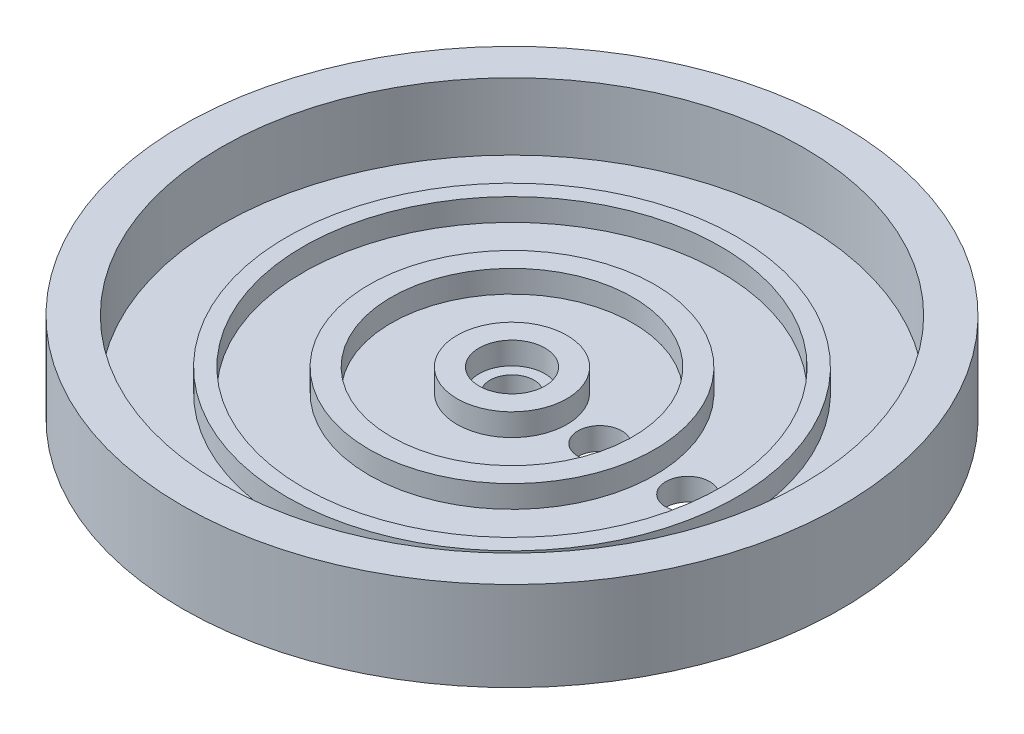
from build123d import *

# Parameters (mm, degrees)
SKETCH2_R           = 15
SKETCH2_R_2         = 1
BOSS_EXTRUDE2_DEPTH = 1.016
SKETCH3_R           = 15
SKETCH3_R_2         = 13.25
SKETCH3_R_3         = 10.25
SKETCH3_R_4         = 9.5
SKETCH3_R_5         = 6.5
SKETCH3_R_6         = 5.5
SKETCH3_R_7         = 2.5
SKETCH3_R_8         = 1.5
BOSS_EXTRUDE4_DEPTH = 1.016
SKETCH5_R           = 15
SKETCH5_R_2         = 13.25
BOSS_EXTRUDE5_DEPTH = 2.032


with BuildPart() as part:
    # Sketch2 → Boss-Extrude2 (new body)
    with BuildSketch(Plane(origin=(0, 0, 0), x_dir=(1, 0, 0), z_dir=(0, 1, 0))):
        Circle(SKETCH2_R)
        Circle(SKETCH2_R_2, mode=Mode.SUBTRACT)
        with Locations((4, 0)):
            Circle(SKETCH2_R_2, mode=Mode.SUBTRACT)
        with Locations((8, 0)):
            Circle(SKETCH2_R_2, mode=Mode.SUBTRACT)
    extrude(amount=BOSS_EXTRUDE2_DEPTH)

    # Sketch3 → Boss-Extrude4 (add)
    # profile 1 of 4: a face of its own
    with BuildSketch(Plane(origin=(0, 1.016, 0), x_dir=(1, 0, 0), z_dir=(0, 1, 0))):
        Circle(SKETCH3_R)
        Circle(SKETCH3_R_2, mode=Mode.SUBTRACT)
    # profile 2 of 4: a face of its own
    with BuildSketch(Plane(origin=(0, 1.016, 0), x_dir=(1, 0, 0), z_dir=(0, 1, 0))):
        Circle(SKETCH3_R_3)
        Circle(SKETCH3_R_4, mode=Mode.SUBTRACT)
    # profile 3 of 4: a face of its own
    with BuildSketch(Plane(origin=(0, 1.016, 0), x_dir=(1, 0, 0), z_dir=(0, 1, 0))):
        Circle(SKETCH3_R_5)
        Circle(SKETCH3_R_6, mode=Mode.SUBTRACT)
    # profile 4 of 4: a face of its own
    with BuildSketch(Plane(origin=(0, 1.016, 0), x_dir=(1, 0, 0), z_dir=(0, 1, 0))):
        Circle(SKETCH3_R_7)
        Circle(SKETCH3_R_8, mode=Mode.SUBTRACT)
    extrude(amount=BOSS_EXTRUDE4_DEPTH)

    # Sketch5 → Boss-Extrude5 (add)
    with BuildSketch(Plane(origin=(0, 2.032, 0), x_dir=(1, 0, 0), z_dir=(0, 1, 0))):
        Circle(SKETCH5_R)
        Circle(SKETCH5_R_2, mode=Mode.SUBTRACT)
    extrude(amount=BOSS_EXTRUDE5_DEPTH)


solid = part.part
